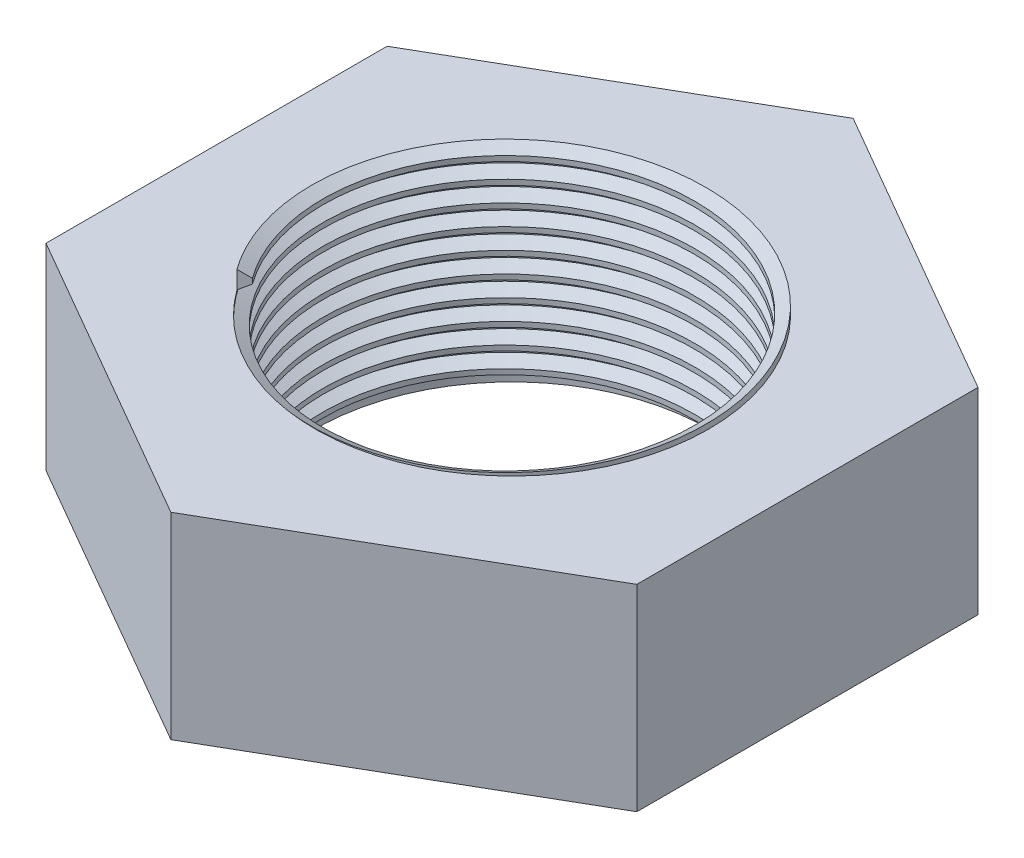
from build123d import *

# Parameters (mm, degrees)
SKETCH1_R           = 5.08
BOSS_EXTRUDE1_DEPTH = 5.08
THREAD1_PITCH       = 0.529166667


with BuildPart() as part:
    # Sketch1 → Boss-Extrude1 (new body)
    with BuildSketch(Plane(origin=(0, 0, 0), x_dir=(1, 0, 0), z_dir=(0, 1, 0))):
        Polygon((0, 8.798818102), (-7.62, 4.399409051), (-7.62, -4.399409051), (0, -8.798818102), (7.62, -4.399409051), (7.62, 4.399409051), align=None)
        with Locations(Location((0, 0, 0), (0, 0, 270))):
            Circle(SKETCH1_R, mode=Mode.SUBTRACT)
    extrude(amount=BOSS_EXTRUDE1_DEPTH)

    # Thread1: the profile of Thread Profile1 profile screwed along a right-hand helix of 9.6 turns, 6 arcs to a turn; built about Z, then put on its axis
    thread1_z = Axis((0, 0, 0), (0, 0, 1))
    thread1_corners = [(5.0803, 0, -0.000173205), (5.0803, 0, 0.463194037), (4.793580141, 0, 0.297656249), (4.793580141, 0, 0.165364583)]
    with BuildLine(mode=Mode.PRIVATE) as thread1_profile:
        Line(thread1_corners[0], thread1_corners[1])
        Line(thread1_corners[1], thread1_corners[2])
        Line(thread1_corners[2], thread1_corners[3])
        Line(thread1_corners[3], thread1_corners[0])
    thread1_cap = Face(thread1_profile.wire())
    thread1_turn_angles = [0, 30, 60, 90, 120, 150, 180, 210, 240, 270, 300, 330, 360]
    thread1_turn_weights = [1, 0.8660254037844387, 1, 0.8660254037844387, 1, 0.8660254037844387, 1, 0.8660254037844387, 1, 0.8660254037844387, 1, 0.8660254037844387, 1]
    thread1_turn_rails = [Edge.make_bspline([Vector(p[0], p[1], 0).rotate(thread1_z, thread1_turn_angles[k]) / thread1_turn_weights[k] + Vector(0, 0, p[2] + THREAD1_PITCH * thread1_turn_angles[k] / 360) for k in range(13)], [0, 0, 0, 1, 1, 2, 2, 3, 3, 4, 4, 5, 5, 6, 6, 6], 2, thread1_turn_weights) for p in thread1_corners]
    thread1_turn_sides = [Face.make_surface_from_curves(thread1_turn_rails[p[0]], thread1_turn_rails[p[1]]) for p in [(0, 1), (1, 2), (2, 3), (3, 0)]]
    thread1_last_angles = [3240, 3270, 3300, 3330, 3360, 3390, 3420, 3438, 3456]
    thread1_last_weights = [1, 0.8660254037844387, 1, 0.8660254037844387, 1, 0.8660254037844387, 1, 0.9510565162951523, 1]
    thread1_last_rails = [Edge.make_bspline([Vector(p[0], p[1], 0).rotate(thread1_z, thread1_last_angles[k]) / thread1_last_weights[k] + Vector(0, 0, p[2] + THREAD1_PITCH * thread1_last_angles[k] / 360) for k in range(9)], [0, 0, 0, 1, 1, 2, 2, 3, 3, 4, 4, 4], 2, thread1_last_weights) for p in thread1_corners]
    thread1_last_sides = [Face.make_surface_from_curves(thread1_last_rails[p[0]], thread1_last_rails[p[1]]) for p in [(0, 1), (1, 2), (2, 3), (3, 0)]]
    thread1 = Plane(origin=(0, 0, 0), x_dir=(1, 0, 0), z_dir=(0, 1, 0)) * Solid(Shell([*[p.moved(Location((0, 0, THREAD1_PITCH * i))) for i in range(9) for p in thread1_turn_sides], *thread1_last_sides, thread1_cap, thread1_cap.rotate(thread1_z, 3456).moved(Location((0, 0, THREAD1_PITCH * 3456 / 360)))]))
    add(thread1)


solid = part.part
